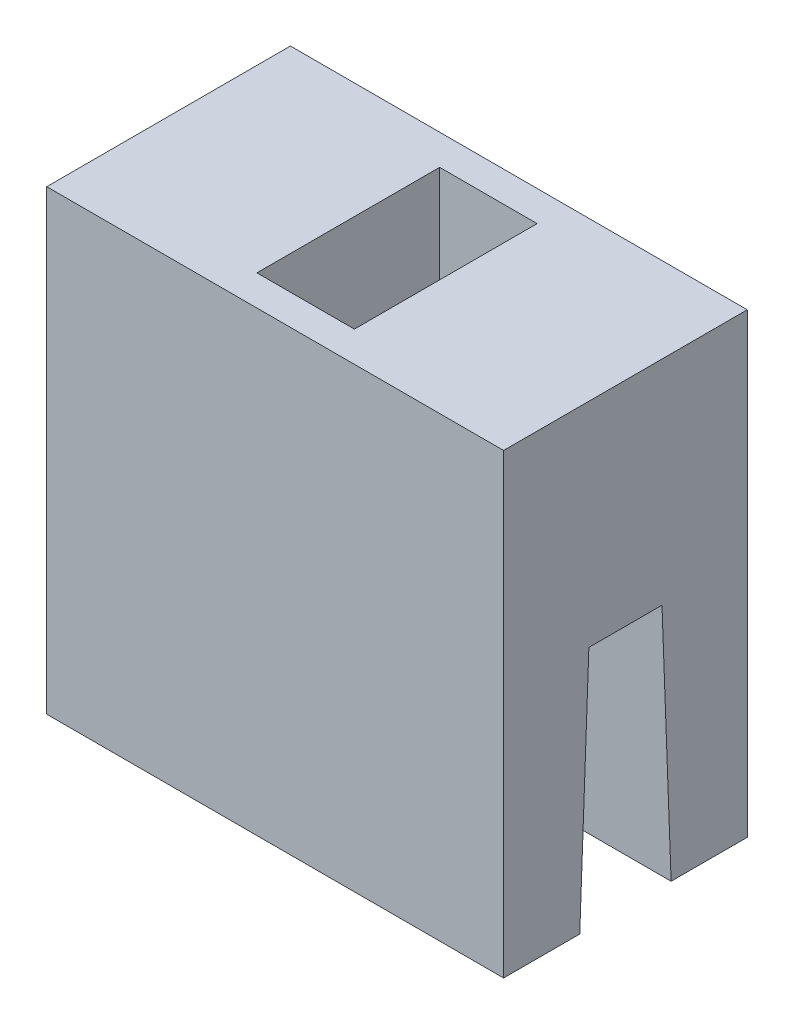
from build123d import *

# Parameters (mm, degrees)
BOSS_EXTRUDE1_DEPTH = 7.5
SKETCH2_W           = 3.2
SKETCH2_H           = 6
CUT_EXTRUDE1_DEPTH  = 5
FILLET1_R           = 1.5


with BuildPart() as part:
    # Sketch1 → Boss-Extrude1 (new, symmetric)
    with BuildSketch(Plane(origin=(0, 0, 0), x_dir=(0, 0, -1), z_dir=(1, 0, 0))):
        Polygon((-1.5, 0), (-1.2, 8), (1.2, 8), (1.5, 0), (4, 0), (4, 15), (-4, 15), (-4, 0), align=None)
    extrude(amount=BOSS_EXTRUDE1_DEPTH, both=True)

    # Sketch2 → Cut-Extrude1 (cut)
    with BuildSketch(Plane(origin=(0, 15, 0), x_dir=(1, 0, 0), z_dir=(0, 1, 0))):
        Rectangle(SKETCH2_W, SKETCH2_H)
    extrude(amount=-CUT_EXTRUDE1_DEPTH, mode=Mode.SUBTRACT)

    # Fillet1
    fillet1_edges = [part.edges().sort_by_distance(p)[0] for p in [
        (-1.6, 10, 0),
        (1.6, 10, 0),
    ]]
    fillet(fillet1_edges, radius=FILLET1_R)


solid = part.part
